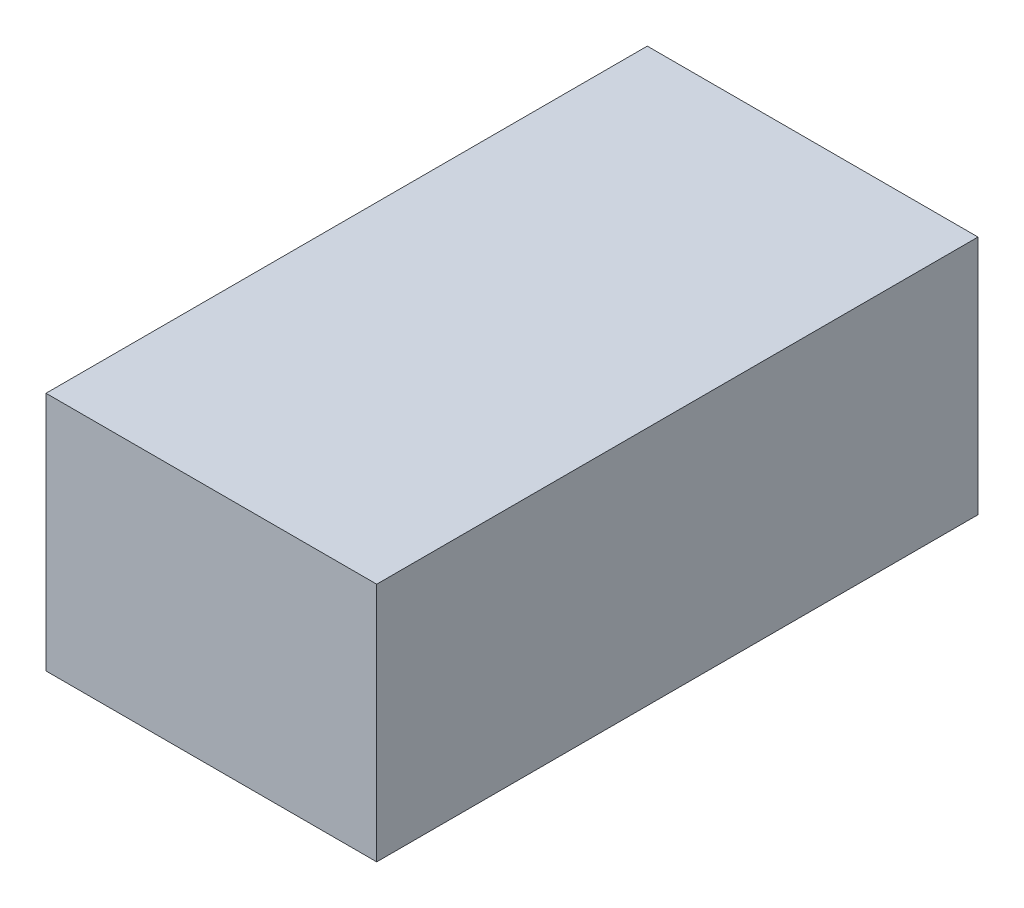
from build123d import *

# Parameters (mm, degrees)
SKETCH_1_W      = 1.3
SKETCH_1_H      = 5
SKETCH_2_W      = 11
SKETCH_2_H      = 8
EXTRUDE_1_DEPTH = 10
SKETCH_2_4_W    = 0.75
SKETCH_2_4_H    = 4
SKETCH_2_4_W_2  = 1.05
SKETCH_2_4_H_2  = 1
SKETCH_1_3_W    = 1.3
SKETCH_1_3_H    = 5


with BuildPart() as part:
    # 草图1 → 旋转1 (revolve)
    with BuildSketch(Plane.XY):
        with Locations((0.65, 2.5)):
            Rectangle(SKETCH_1_W, SKETCH_1_H)
        Polygon((1.3, 0), (0, 0), (0, -1.5), (2, -1.5), (2, 0), align=None)
    revolve(axis=Axis((0, 0, 0), (0, 1, 0)))

    # 草图2 → 凸台-拉伸1 (add, symmetric)
    with BuildSketch(Plane.XY):
        with Locations((0, 2)):
            Rectangle(SKETCH_2_W, SKETCH_2_H)
    extrude(amount=EXTRUDE_1_DEPTH, both=True)

    # 草图2<4> → 切除-旋转1 (revolve, cut)
    with BuildSketch(Plane.XY):
        with Locations((0.375, 3)):
            Rectangle(SKETCH_2_4_W, SKETCH_2_4_H)
        with Locations((1.275, 0.5)):
            Rectangle(SKETCH_2_4_W_2, SKETCH_2_4_H_2)
        with Locations((0.375, 0.5)):
            Rectangle(SKETCH_2_4_W, SKETCH_2_4_H_2)
        Polygon((1.8, 0), (0.75, 0), (0, 0), (0, -2), (2.5, -2), (2.5, 0), align=None)
    revolve(axis=Axis((0, 0, 0), (0, -1, 0)), mode=Mode.SUBTRACT)

    # 草图1<3> → 旋转2 (revolve)
    with BuildSketch(Plane.XY):
        with Locations((0.65, 2.5)):
            Rectangle(SKETCH_1_3_W, SKETCH_1_3_H)
        Polygon((1.3, 0), (0, 0), (0, -1.5), (2, -1.5), (2, 0), align=None)
    revolve(axis=Axis((0, 0, 0), (0, 1, 0)))


solid = part.part
